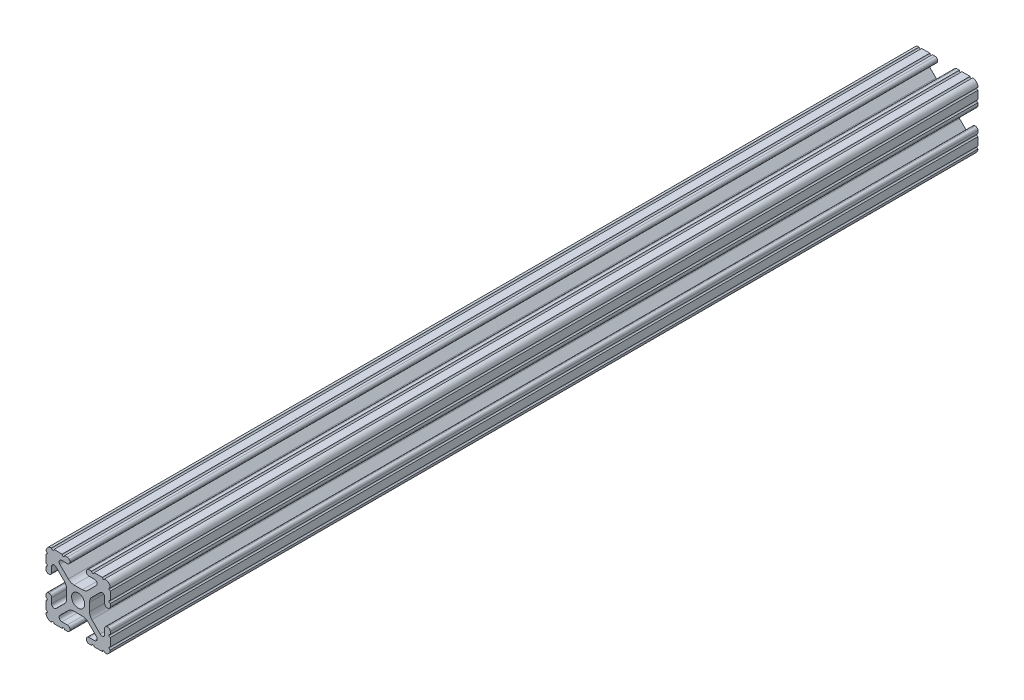
from build123d import *

# Parameters (mm, degrees)
SKETCH1_R           = 2.6035
BOSS_EXTRUDE1_DEPTH = 215.9
CUT_EXTRUDE1_START  = -88.9
CUT_EXTRUDE1_DEPTH  = 88.9
SKETCH3_R           = 3.175
CUT_EXTRUDE2_DEPTH  = 218.759638133
SKETCH4_R           = 4.7625
CUT_EXTRUDE3_DEPTH  = 8.2042


with BuildPart() as part:
    # Sketch1 → Boss-Extrude1 (new, symmetric)
    with BuildSketch(Plane.XY):
        with BuildLine():
            Line((-7.179650497, -8.645192506), (-3.952270251, -5.423690499))
            ThreePointArc((-3.952270251, -5.423690499), (-2.922936451, -4.736929036), (-1.709253557, -4.4958))
            Line((-1.709253557, -4.4958), (1.709253557, -4.4958))
            ThreePointArc((1.709253557, -4.4958), (2.922936451, -4.736929036), (3.952270251, -5.423690499))
            Line((3.952270251, -5.423690499), (7.179650497, -8.645192506))
            ThreePointArc((7.179650497, -8.645192506), (7.41473083, -9.822813117), (6.416408329, -10.4902))
            Line((6.416408329, -10.4902), (4.287512407, -10.4902))
            ThreePointArc((4.287512407, -10.4902), (3.54574862, -10.79744862), (3.2385, -11.539212407))
            Line((3.2385, -11.539212407), (3.2385, -11.650987593))
            ThreePointArc((3.2385, -11.650987593), (3.54574862, -12.39275138), (4.287512407, -12.7))
            Line((4.287512407, -12.7), (5.317126718, -12.7))
            ThreePointArc((5.317126718, -12.7), (5.825126718, -12.192), (6.333126718, -12.7))
            Line((6.333126718, -12.7), (9.550443118, -12.7))
            ThreePointArc((9.550443118, -12.7), (10.058366869, -12.192000006), (10.566443095, -12.699847501))
            ThreePointArc((10.566443095, -12.699847501), (12.082537762, -12.08250727), (12.699846982, -10.566399977))
            ThreePointArc((12.699846982, -10.566399977), (12.192000006, -10.058323491), (12.7, -9.5504))
            Line((12.7, -9.5504), (12.7, -6.3330836))
            ThreePointArc((12.7, -6.3330836), (12.192, -5.8250836), (12.7, -5.3170836))
            Line((12.7, -5.3170836), (12.7, -4.287469289))
            ThreePointArc((12.7, -4.287469289), (12.39275138, -3.545705502), (11.650987593, -3.238456882))
            Line((11.650987593, -3.238456882), (11.539212407, -3.238456882))
            ThreePointArc((11.539212407, -3.238456882), (10.79744862, -3.545705502), (10.4902, -4.287469289))
            Line((10.4902, -4.287469289), (10.4902, -6.402089023))
            ThreePointArc((10.4902, -6.402089023), (9.856505071, -7.351067942), (8.737131347, -7.129408934))
            Line((8.737131347, -7.129408934), (5.441005833, -3.840816462))
            ThreePointArc((5.441005833, -3.840816462), (4.750877967, -2.809883091), (4.5085, -1.593185507))
            Line((4.5085, -1.593185507), (4.5085, 1.593185507))
            ThreePointArc((4.5085, 1.593185507), (4.750877967, 2.809883091), (5.441005833, 3.840816462))
            Line((5.441005833, 3.840816462), (8.737131347, 7.129408934))
            ThreePointArc((8.737131347, 7.129408934), (9.856505071, 7.351067942), (10.4902, 6.402089023))
            Line((10.4902, 6.402089023), (10.4902, 4.287469289))
            ThreePointArc((10.4902, 4.287469289), (10.79744862, 3.545705502), (11.539212407, 3.238456882))
            Line((11.539212407, 3.238456882), (11.650987593, 3.238456882))
            ThreePointArc((11.650987593, 3.238456882), (12.39275138, 3.545705502), (12.7, 4.287469289))
            Line((12.7, 4.287469289), (12.7, 5.3170836))
            ThreePointArc((12.7, 5.3170836), (12.192, 5.8250836), (12.7, 6.3330836))
            Line((12.7, 6.3330836), (12.7, 9.5504))
            ThreePointArc((12.7, 9.5504), (12.192000006, 10.058323491), (12.699846982, 10.566399977))
            ThreePointArc((12.699846982, 10.566399977), (12.082537762, 12.08250727), (10.566443095, 12.699847501))
            ThreePointArc((10.566443095, 12.699847501), (10.058366869, 12.192000006), (9.550443118, 12.7))
            Line((9.550443118, 12.7), (6.333126718, 12.7))
            ThreePointArc((6.333126718, 12.7), (5.825126718, 12.192), (5.317126718, 12.7))
            Line((5.317126718, 12.7), (4.287512407, 12.7))
            ThreePointArc((4.287512407, 12.7), (3.54574862, 12.39275138), (3.2385, 11.650987593))
            Line((3.2385, 11.650987593), (3.2385, 11.539212407))
            ThreePointArc((3.2385, 11.539212407), (3.54574862, 10.79744862), (4.287512407, 10.4902))
            Line((4.287512407, 10.4902), (6.476788598, 10.4902))
            ThreePointArc((6.476788598, 10.4902), (7.432222385, 9.85140422), (7.207036008, 8.724370562))
            Line((7.207036008, 8.724370562), (3.898272566, 5.423169045))
            ThreePointArc((3.898272566, 5.423169045), (2.869120213, 4.736787962), (1.655778399, 4.4958))
            Line((1.655778399, 4.4958), (-1.655778399, 4.4958))
            ThreePointArc((-1.655778399, 4.4958), (-2.869120213, 4.736787962), (-3.898272566, 5.423169045))
            Line((-3.898272566, 5.423169045), (-7.207036008, 8.724370562))
            ThreePointArc((-7.207036008, 8.724370562), (-7.432222385, 9.85140422), (-6.476788598, 10.4902))
            Line((-6.476788598, 10.4902), (-4.287512407, 10.4902))
            ThreePointArc((-4.287512407, 10.4902), (-3.54574862, 10.79744862), (-3.2385, 11.539212407))
            Line((-3.2385, 11.539212407), (-3.2385, 11.650987593))
            ThreePointArc((-3.2385, 11.650987593), (-3.54574862, 12.39275138), (-4.287512407, 12.7))
            Line((-4.287512407, 12.7), (-5.317126718, 12.7))
            ThreePointArc((-5.317126718, 12.7), (-5.825126718, 12.192), (-6.333126718, 12.7))
            Line((-6.333126718, 12.7), (-9.550443118, 12.7))
            ThreePointArc((-9.550443118, 12.7), (-10.058366869, 12.192000006), (-10.566443095, 12.699847501))
            ThreePointArc((-10.566443095, 12.699847501), (-12.082537762, 12.08250727), (-12.699846982, 10.566399977))
            ThreePointArc((-12.699846982, 10.566399977), (-12.192000006, 10.058323491), (-12.7, 9.5504))
            Line((-12.7, 9.5504), (-12.7, 6.3330836))
            ThreePointArc((-12.7, 6.3330836), (-12.192, 5.8250836), (-12.7, 5.3170836))
            Line((-12.7, 5.3170836), (-12.7, 4.287469289))
            ThreePointArc((-12.7, 4.287469289), (-12.39275138, 3.545705502), (-11.650987593, 3.238456882))
            Line((-11.650987593, 3.238456882), (-11.539212407, 3.238456882))
            ThreePointArc((-11.539212407, 3.238456882), (-10.79744862, 3.545705502), (-10.4902, 4.287469289))
            Line((-10.4902, 4.287469289), (-10.4902, 6.402089023))
            ThreePointArc((-10.4902, 6.402089023), (-9.856505071, 7.351067942), (-8.737131347, 7.129408934))
            Line((-8.737131347, 7.129408934), (-5.441005833, 3.840816462))
            ThreePointArc((-5.441005833, 3.840816462), (-4.750877967, 2.809883091), (-4.5085, 1.593185507))
            Line((-4.5085, 1.593185507), (-4.5085, -1.593185507))
            ThreePointArc((-4.5085, -1.593185507), (-4.750877967, -2.809883091), (-5.441005833, -3.840816462))
            Line((-5.441005833, -3.840816462), (-8.737131347, -7.129408934))
            ThreePointArc((-8.737131347, -7.129408934), (-9.856505071, -7.351067942), (-10.4902, -6.402089023))
            Line((-10.4902, -6.402089023), (-10.4902, -4.287469289))
            ThreePointArc((-10.4902, -4.287469289), (-10.79744862, -3.545705502), (-11.539212407, -3.238456882))
            Line((-11.539212407, -3.238456882), (-11.650987593, -3.238456882))
            ThreePointArc((-11.650987593, -3.238456882), (-12.39275138, -3.545705502), (-12.7, -4.287469289))
            Line((-12.7, -4.287469289), (-12.7, -5.3170836))
            ThreePointArc((-12.7, -5.3170836), (-12.192, -5.8250836), (-12.7, -6.3330836))
            Line((-12.7, -6.3330836), (-12.7, -9.5504))
            ThreePointArc((-12.7, -9.5504), (-12.192000006, -10.058323491), (-12.699846982, -10.566399977))
            ThreePointArc((-12.699846982, -10.566399977), (-12.082537762, -12.08250727), (-10.566443095, -12.699847501))
            ThreePointArc((-10.566443095, -12.699847501), (-10.058366869, -12.192000006), (-9.550443118, -12.7))
            Line((-9.550443118, -12.7), (-6.333126718, -12.7))
            ThreePointArc((-6.333126718, -12.7), (-5.825126718, -12.192), (-5.317126718, -12.7))
            Line((-5.317126718, -12.7), (-4.287512407, -12.7))
            ThreePointArc((-4.287512407, -12.7), (-3.54574862, -12.39275138), (-3.2385, -11.650987593))
            Line((-3.2385, -11.650987593), (-3.2385, -11.539212407))
            ThreePointArc((-3.2385, -11.539212407), (-3.54574862, -10.79744862), (-4.287512407, -10.4902))
            Line((-4.287512407, -10.4902), (-6.416408329, -10.4902))
            ThreePointArc((-6.416408329, -10.4902), (-7.41473083, -9.822813117), (-7.179650497, -8.645192506))
        make_face()
        Circle(SKETCH1_R, mode=Mode.SUBTRACT)
    extrude(amount=BOSS_EXTRUDE1_DEPTH, both=True)

    # Sketch2 → Cut-Extrude1 (cut)
    with BuildSketch(Plane(origin=(0, 0, -215.9), x_dir=(-1, 0, 0), z_dir=(0, 0, -1)).offset(CUT_EXTRUDE1_START)):
        with BuildLine():
            Line((6.416408329, -10.4902), (4.287512407, -10.4902))
            ThreePointArc((4.287512407, -10.4902), (3.54574862, -10.79744862), (3.2385, -11.539212407))
            Line((3.2385, -11.539212407), (3.2385, -11.650987593))
            ThreePointArc((3.2385, -11.650987593), (3.54574862, -12.39275138), (4.287512407, -12.7))
            Line((4.287512407, -12.7), (5.317126718, -12.7))
            ThreePointArc((5.317126718, -12.7), (5.825126718, -12.192), (6.333126718, -12.7))
            Line((6.333126718, -12.7), (9.550443118, -12.7))
            ThreePointArc((9.550443118, -12.7), (10.058366869, -12.192000006), (10.566443095, -12.699847501))
            ThreePointArc((10.566443095, -12.699847501), (12.082537762, -12.08250727), (12.699846982, -10.566399977))
            ThreePointArc((12.699846982, -10.566399977), (12.192000006, -10.058323491), (12.7, -9.5504))
            Line((12.7, -9.5504), (12.7, -6.3330836))
            ThreePointArc((12.7, -6.3330836), (12.192, -5.8250836), (12.7, -5.3170836))
            Line((12.7, -5.3170836), (12.7, -4.287469289))
            ThreePointArc((12.7, -4.287469289), (12.39275138, -3.545705502), (11.650987593, -3.238456882))
            Line((11.650987593, -3.238456882), (11.539212407, -3.238456882))
            ThreePointArc((11.539212407, -3.238456882), (10.79744862, -3.545705502), (10.4902, -4.287469289))
            Line((10.4902, -4.287469289), (10.4902, -6.402089023))
            ThreePointArc((10.4902, -6.402089023), (9.856505071, -7.351067942), (8.737131347, -7.129408934))
            Line((8.737131347, -7.129408934), (5.441005833, -3.840816462))
            ThreePointArc((5.441005833, -3.840816462), (4.750877967, -2.809883091), (4.5085, -1.593185507))
            Line((4.5085, -1.593185507), (4.5085, 1.593185507))
            ThreePointArc((4.5085, 1.593185507), (4.750877967, 2.809883091), (5.441005833, 3.840816462))
            Line((5.441005833, 3.840816462), (8.737131347, 7.129408934))
            ThreePointArc((8.737131347, 7.129408934), (9.856505071, 7.351067942), (10.4902, 6.402089023))
            Line((10.4902, 6.402089023), (10.4902, 4.287469289))
            ThreePointArc((10.4902, 4.287469289), (10.79744862, 3.545705502), (11.539212407, 3.238456882))
            Line((11.539212407, 3.238456882), (11.650987593, 3.238456882))
            ThreePointArc((11.650987593, 3.238456882), (12.39275138, 3.545705502), (12.7, 4.287469289))
            Line((12.7, 4.287469289), (12.7, 5.3170836))
            ThreePointArc((12.7, 5.3170836), (12.192, 5.8250836), (12.7, 6.3330836))
            Line((12.7, 6.3330836), (12.7, 9.5504))
            ThreePointArc((12.7, 9.5504), (12.192000006, 10.058323491), (12.699846982, 10.566399977))
            ThreePointArc((12.699846982, 10.566399977), (12.082537762, 12.08250727), (10.566443095, 12.699847501))
            ThreePointArc((10.566443095, 12.699847501), (10.058366869, 12.192000006), (9.550443118, 12.7))
            Line((9.550443118, 12.7), (6.333126718, 12.7))
            ThreePointArc((6.333126718, 12.7), (5.825126718, 12.192), (5.317126718, 12.7))
            Line((5.317126718, 12.7), (4.287512407, 12.7))
            ThreePointArc((4.287512407, 12.7), (3.54574862, 12.39275138), (3.2385, 11.650987593))
            Line((3.2385, 11.650987593), (3.2385, 11.539212407))
            ThreePointArc((3.2385, 11.539212407), (3.54574862, 10.79744862), (4.287512407, 10.4902))
            Line((4.287512407, 10.4902), (6.476788598, 10.4902))
            ThreePointArc((6.476788598, 10.4902), (7.432222385, 9.85140422), (7.207036008, 8.724370562))
            Line((7.207036008, 8.724370562), (3.898272566, 5.423169045))
            ThreePointArc((3.898272566, 5.423169045), (2.869120213, 4.736787962), (1.655778399, 4.4958))
            Line((1.655778399, 4.4958), (-1.655778399, 4.4958))
            ThreePointArc((-1.655778399, 4.4958), (-2.869120213, 4.736787962), (-3.898272566, 5.423169045))
            Line((-3.898272566, 5.423169045), (-7.207036008, 8.724370562))
            ThreePointArc((-7.207036008, 8.724370562), (-7.432222385, 9.85140422), (-6.476788598, 10.4902))
            Line((-6.476788598, 10.4902), (-4.287512407, 10.4902))
            ThreePointArc((-4.287512407, 10.4902), (-3.54574862, 10.79744862), (-3.2385, 11.539212407))
            Line((-3.2385, 11.539212407), (-3.2385, 11.650987593))
            ThreePointArc((-3.2385, 11.650987593), (-3.54574862, 12.39275138), (-4.287512407, 12.7))
            Line((-4.287512407, 12.7), (-5.317126718, 12.7))
            ThreePointArc((-5.317126718, 12.7), (-5.825126718, 12.192), (-6.333126718, 12.7))
            Line((-6.333126718, 12.7), (-9.550443118, 12.7))
            ThreePointArc((-9.550443118, 12.7), (-10.058366869, 12.192000006), (-10.566443095, 12.699847501))
            ThreePointArc((-10.566443095, 12.699847501), (-12.082537762, 12.08250727), (-12.699846982, 10.566399977))
            ThreePointArc((-12.699846982, 10.566399977), (-12.192000006, 10.058323491), (-12.7, 9.5504))
            Line((-12.7, 9.5504), (-12.7, 6.3330836))
            ThreePointArc((-12.7, 6.3330836), (-12.192, 5.8250836), (-12.7, 5.3170836))
            Line((-12.7, 5.3170836), (-12.7, 4.287469289))
            ThreePointArc((-12.7, 4.287469289), (-12.39275138, 3.545705502), (-11.650987593, 3.238456882))
            Line((-11.650987593, 3.238456882), (-11.539212407, 3.238456882))
            ThreePointArc((-11.539212407, 3.238456882), (-10.79744862, 3.545705502), (-10.4902, 4.287469289))
            Line((-10.4902, 4.287469289), (-10.4902, 6.402089023))
            ThreePointArc((-10.4902, 6.402089023), (-9.856505071, 7.351067942), (-8.737131347, 7.129408934))
            Line((-8.737131347, 7.129408934), (-5.441005833, 3.840816462))
            ThreePointArc((-5.441005833, 3.840816462), (-4.750877967, 2.809883091), (-4.5085, 1.593185507))
            Line((-4.5085, 1.593185507), (-4.5085, -1.593185507))
            ThreePointArc((-4.5085, -1.593185507), (-4.750877967, -2.809883091), (-5.441005833, -3.840816462))
            Line((-5.441005833, -3.840816462), (-8.737131347, -7.129408934))
            ThreePointArc((-8.737131347, -7.129408934), (-9.856505071, -7.351067942), (-10.4902, -6.402089023))
            Line((-10.4902, -6.402089023), (-10.4902, -4.287469289))
            ThreePointArc((-10.4902, -4.287469289), (-10.79744862, -3.545705502), (-11.539212407, -3.238456882))
            Line((-11.539212407, -3.238456882), (-11.650987593, -3.238456882))
            ThreePointArc((-11.650987593, -3.238456882), (-12.39275138, -3.545705502), (-12.7, -4.287469289))
            Line((-12.7, -4.287469289), (-12.7, -5.3170836))
            ThreePointArc((-12.7, -5.3170836), (-12.192, -5.8250836), (-12.7, -6.3330836))
            Line((-12.7, -6.3330836), (-12.7, -9.5504))
            ThreePointArc((-12.7, -9.5504), (-12.192000006, -10.058323491), (-12.699846982, -10.566399977))
            ThreePointArc((-12.699846982, -10.566399977), (-12.082537762, -12.08250727), (-10.566443095, -12.699847501))
            ThreePointArc((-10.566443095, -12.699847501), (-10.058366869, -12.192000006), (-9.550443118, -12.7))
            Line((-9.550443118, -12.7), (-6.333126718, -12.7))
            ThreePointArc((-6.333126718, -12.7), (-5.825126718, -12.192), (-5.317126718, -12.7))
            Line((-5.317126718, -12.7), (-4.287512407, -12.7))
            ThreePointArc((-4.287512407, -12.7), (-3.54574862, -12.39275138), (-3.2385, -11.650987593))
            Line((-3.2385, -11.650987593), (-3.2385, -11.539212407))
            ThreePointArc((-3.2385, -11.539212407), (-3.54574862, -10.79744862), (-4.287512407, -10.4902))
            Line((-4.287512407, -10.4902), (-6.416408329, -10.4902))
            ThreePointArc((-6.416408329, -10.4902), (-7.41473083, -9.822813117), (-7.179650497, -8.645192506))
            Line((-7.179650497, -8.645192506), (-3.952270251, -5.423690499))
            ThreePointArc((-3.952270251, -5.423690499), (-2.922936451, -4.736929036), (-1.709253557, -4.4958))
            Line((-1.709253557, -4.4958), (1.709253557, -4.4958))
            ThreePointArc((1.709253557, -4.4958), (2.922936451, -4.736929036), (3.952270251, -5.423690499))
            Line((3.952270251, -5.423690499), (7.179650497, -8.645192506))
            ThreePointArc((7.179650497, -8.645192506), (7.41473083, -9.822813117), (6.416408329, -10.4902))
        make_face()
    extrude(amount=CUT_EXTRUDE1_DEPTH, mode=Mode.SUBTRACT)

    # Sketch3 → Cut-Extrude2 (cut, through all)
    with BuildSketch(Plane(origin=(0, 12.7, 0), x_dir=(1, 0, 0), z_dir=(0, 1, 0))):
        with Locations(Location((0, -44.45, 0), (0, 0, 301.433258669))):
            Circle(SKETCH3_R)
        with Locations(Location((0, -165.1, 0), (0, 0, 301.433258669))):
            Circle(SKETCH3_R)
        with Locations(Location((0, 76.2, 0), (0, 0, 301.433258669))):
            Circle(SKETCH3_R)
    extrude(amount=-CUT_EXTRUDE2_DEPTH, mode=Mode.SUBTRACT)

    # Sketch4 → Cut-Extrude3 (cut)
    with BuildSketch(Plane.XZ.offset(12.7)):
        with Locations((0, -76.2)):
            Circle(SKETCH4_R)
        with Locations((0, 44.45)):
            Circle(SKETCH4_R)
        with Locations((0.461250136, 164.489203868)):
            Circle(SKETCH4_R)
    extrude(amount=-CUT_EXTRUDE3_DEPTH, mode=Mode.SUBTRACT)


solid = part.part
